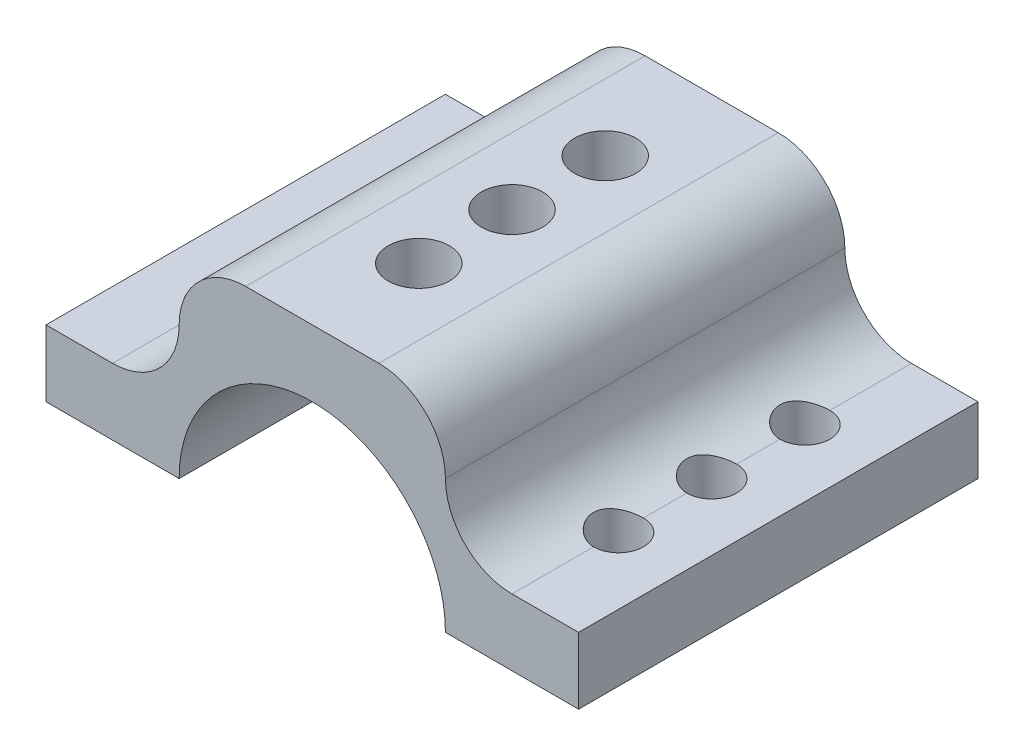
from build123d import *

# Parameters (mm, degrees)
SKETCH1_W           = 50.8
SKETCH1_H           = 38.1
SKETCH1_R           = 2.38125
BOSS_EXTRUDE1_DEPTH = 25.4
CUT_EXTRUDE1_DEPTH  = 58.410261207
FILLET1_R           = 6.35
SKETCH3_R           = 2.921
CUT_EXTRUDE2_DEPTH  = 25.4


with BuildPart() as part:
    # Sketch1 → Boss-Extrude1 (new body)
    with BuildSketch(Plane(origin=(0, 0, 0), x_dir=(1, 0, 0), z_dir=(0, 1, 0))):
        with Locations((-9.229006509, -1.483233189)):
            Rectangle(SKETCH1_W, SKETCH1_H)
        with Locations(Location((-28.279006509, 7.406766811, 0), (0, 0, 270))):
            Circle(SKETCH1_R, mode=Mode.SUBTRACT)
        with Locations(Location((-28.279006509, -1.483233189, 0), (0, 0, 270))):
            Circle(SKETCH1_R, mode=Mode.SUBTRACT)
        with Locations(Location((-28.279006509, -10.373233189, 0), (0, 0, 270))):
            Circle(SKETCH1_R, mode=Mode.SUBTRACT)
        with Locations(Location((9.820993491, -10.373233189, 0), (0, 0, 270))):
            Circle(SKETCH1_R, mode=Mode.SUBTRACT)
        with Locations(Location((9.820993491, -1.483233189, 0), (0, 0, 270))):
            Circle(SKETCH1_R, mode=Mode.SUBTRACT)
        with Locations(Location((9.820993491, 7.406766811, 0), (0, 0, 270))):
            Circle(SKETCH1_R, mode=Mode.SUBTRACT)
    extrude(amount=BOSS_EXTRUDE1_DEPTH)

    # Sketch2 → Cut-Extrude1 (cut, through all)
    with BuildSketch(Plane.XY.offset(20.533233189)):
        with BuildLine():
            Line((-21.929006509, 0), (3.470993491, 0))
            ThreePointArc((3.470993491, 0), (-9.229006509, 12.7), (-21.929006509, 0))
        make_face()
        Polygon((-25.739006509, 25.4), (7.280993491, 25.4), (16.170993491, 25.4), (16.170993491, 6.35), (3.470993491, 6.35), (3.470993491, 19.05), (-21.929006509, 19.05), (-21.929006509, 6.35), (-34.629006509, 6.35), (-34.629006509, 25.4), align=None)
    extrude(amount=-CUT_EXTRUDE1_DEPTH, mode=Mode.SUBTRACT)

    # Fillet1
    # the kernel refuses this fillet: 6.35 mm, written as the material it adds along each edge
    with BuildSketch(Plane(origin=(3.470993491, 6.35, 20.533233189), x_dir=(1, 0, 0), z_dir=(0, 0, -1))) as fillet1_piece_1_section:
        with BuildLine():
            CenterArc((FILLET1_R, -FILLET1_R), FILLET1_R, 90, 90)
            Line((0, -FILLET1_R), (0, 0))
            Line((0, 0), (FILLET1_R, 0))
        make_face()
    fillet1_piece_1 = extrude(amount=38.1, mode=Mode.PRIVATE)
    fillet1_piece_1 = fillet1_piece_1 - Plane(origin=(9.820993491, 7.811257132, -7.406766811), x_dir=(0, 0, 1), z_dir=(0, -1, 0)) * Cylinder(2.38125, 102, mode=Mode.PRIVATE)
    fillet1_piece_1 = fillet1_piece_1 - Plane(origin=(9.820993491, 7.811257132, 1.483233189), x_dir=(0, 0, 1), z_dir=(0, -1, 0)) * Cylinder(2.38125, 102, mode=Mode.PRIVATE)
    fillet1_piece_1 = fillet1_piece_1 - Plane(origin=(9.820993491, 7.811257132, 10.373233189), x_dir=(0, 0, 1), z_dir=(0, -1, 0)) * Cylinder(2.38125, 102, mode=Mode.PRIVATE)
    add(fillet1_piece_1)
    with BuildSketch(Plane(origin=(-21.929006509, 6.35, 20.533233189), x_dir=(0, 1, 0), z_dir=(0, 0, -1))) as fillet1_piece_2_section:
        with BuildLine():
            CenterArc((FILLET1_R, -FILLET1_R), FILLET1_R, 90, 90)
            Line((0, -FILLET1_R), (0, 0))
            Line((0, 0), (FILLET1_R, 0))
        make_face()
    fillet1_piece_2 = extrude(amount=38.1, mode=Mode.PRIVATE)
    fillet1_piece_2 = fillet1_piece_2 - Plane(origin=(-28.279006509, 7.811257363, -7.406766811), x_dir=(0, 0, 1), z_dir=(0, -1, 0)) * Cylinder(2.38125, 102, mode=Mode.PRIVATE)
    fillet1_piece_2 = fillet1_piece_2 - Plane(origin=(-28.279006509, 7.811257363, 1.483233189), x_dir=(0, 0, 1), z_dir=(0, -1, 0)) * Cylinder(2.38125, 102, mode=Mode.PRIVATE)
    fillet1_piece_2 = fillet1_piece_2 - Plane(origin=(-28.279006509, 7.811257363, 10.373233189), x_dir=(0, 0, 1), z_dir=(0, -1, 0)) * Cylinder(2.38125, 102, mode=Mode.PRIVATE)
    add(fillet1_piece_2)
    # the kernel refuses this fillet: 6.35 mm, written as the material it takes off along each edge
    with BuildSketch(Plane(origin=(3.470993491, 19.05, 36.408233189), x_dir=(0, -1, 0), z_dir=(0, 0, -1)), Plane(origin=(-21.929006509, 19.05, 36.408233189), x_dir=(1, 0, 0), z_dir=(0, 0, -1))) as fillet1_2_piece_1:
        with BuildLine():
            CenterArc((FILLET1_R, FILLET1_R), FILLET1_R, 180, 90)
            Line((0, FILLET1_R), (0, 0))
            Line((0, 0), (FILLET1_R, 0))
        make_face()
    extrude(amount=69.85, mode=Mode.SUBTRACT)

    # Sketch3 → Cut-Extrude2 (cut)
    with BuildSketch(Plane(origin=(0, 19.05, 0), x_dir=(1, 0, 0), z_dir=(0, 1, 0))):
        with Locations(Location((-9.229006509, -1.483233189, 0), (0, 0, 270))):
            Circle(SKETCH3_R)
        with Locations(Location((-9.229006509, 7.406766811, 0), (0, 0, 270))):
            Circle(SKETCH3_R)
        with Locations(Location((-9.229006509, -10.373233189, 0), (0, 0, 270))):
            Circle(SKETCH3_R)
    extrude(amount=-CUT_EXTRUDE2_DEPTH, mode=Mode.SUBTRACT)


solid = part.part
